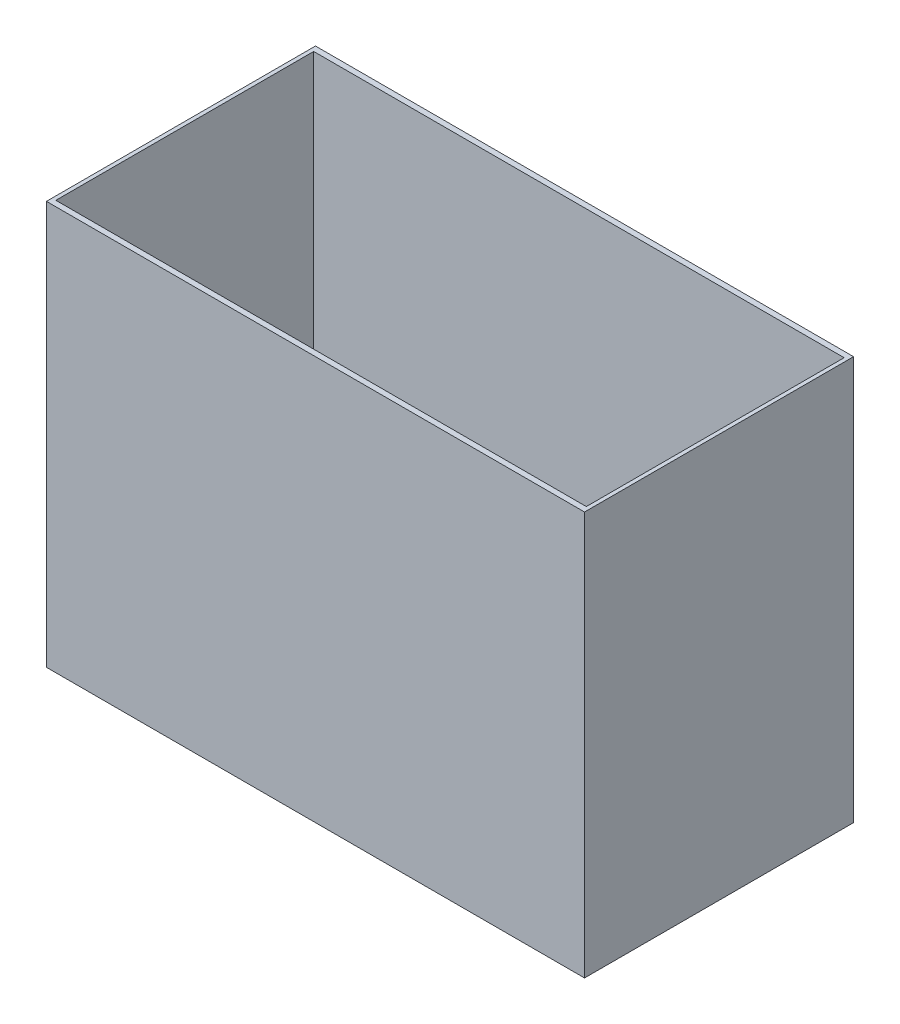
from build123d import *

# Parameters (mm, degrees)
SKETCH1_W           = 584.2
SKETCH1_H           = 279.4
BOSS_EXTRUDE1_DEPTH = 6.35
SKETCH3_W           = 609.6
SKETCH3_H           = 304.8
SKETCH3_W_2         = 600.964
SKETCH3_H_2         = 292.1
BOSS_EXTRUDE3_DEPTH = 457.2
SKETCH4_R           = 2.778125
CUT_EXTRUDE1_DEPTH  = 566.15


with BuildPart() as part:
    # Sketch1 → Boss-Extrude1 (new body)
    with BuildSketch(Plane(origin=(0, 0, 0), x_dir=(1, 0, 0), z_dir=(0, 1, 0))):
        Rectangle(SKETCH1_W, SKETCH1_H)
    extrude(amount=BOSS_EXTRUDE1_DEPTH)

    # Sketch4 → Cut-Extrude1 (cut, through all)
    with BuildSketch(Plane(origin=(0, 6.35, 0), x_dir=(1, 0, 0), z_dir=(0, 1, 0))):
        with Locations((273.05, 120.65)):
            Circle(SKETCH4_R)
    cut_extrude1 = extrude(amount=-CUT_EXTRUDE1_DEPTH, mode=Mode.SUBTRACT)

    # Mirror1: Cut-Extrude1 across plane
    add(cut_extrude1.mirror(Plane.XY), mode=Mode.SUBTRACT)


with BuildPart() as body_2:
    # Sketch3 → Boss-Extrude3 (new body)
    with BuildSketch(Plane(origin=(0, 0, 0), x_dir=(1, 0, 0), z_dir=(0, 1, 0))):
        Rectangle(SKETCH3_W, SKETCH3_H)
        Rectangle(SKETCH3_W_2, SKETCH3_H_2, mode=Mode.SUBTRACT)
    extrude(amount=BOSS_EXTRUDE3_DEPTH)


solid = Compound([part.part, body_2.part])
